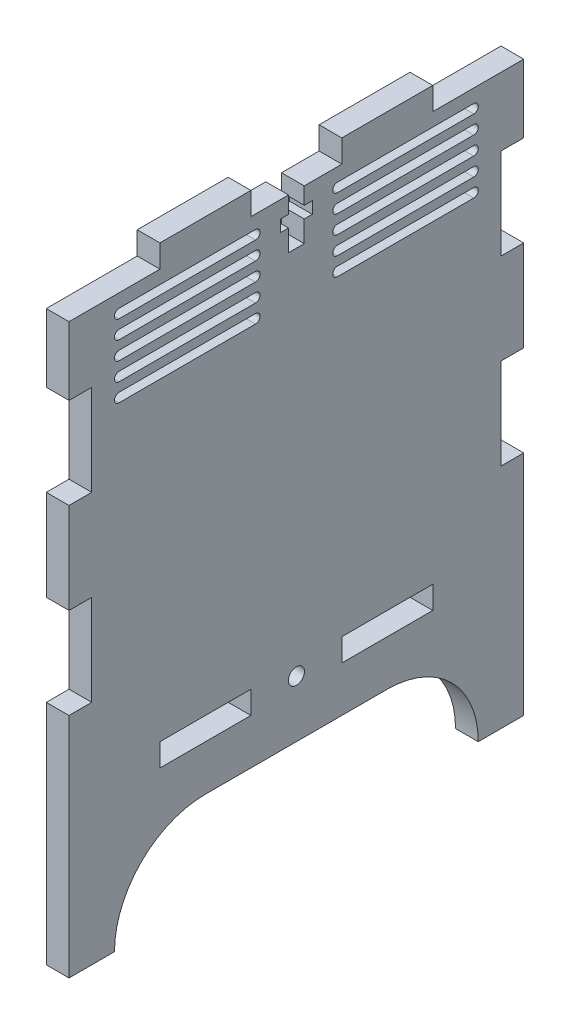
from build123d import *

# Parameters (mm, degrees)
SKETCH1_W                 = 127
SKETCH1_H                 = 165.1
BOSS_EXTRUDE1_DEPTH       = 6.35
SKETCH2_W                 = 25.4
SKETCH2_H                 = 6.35
CUT_EXTRUDE1_DEPTH        = 6.35
LPATTERN1_COUNT           = 3
LPATTERN1_PITCH           = 50.8
CUT_EXTRUDE4_DEPTH        = 6.35
SKETCH8_W                 = 6.35
SKETCH8_H                 = 25.4
CUT_EXTRUDE6_DEPTH        = 6.35
LPATTERN4_COUNT           = 2
LPATTERN4_PITCH           = 50.8
MIRROR1_COPY_1_SKETCH_W   = 6.35
MIRROR1_COPY_1_SKETCH_H   = 25.4
MIRROR1_COPY_1_DEPTH      = 6.35
MIRROR1_COPY_2_SKETCH_W   = 6.35
MIRROR1_COPY_2_SKETCH_H   = 25.4
MIRROR1_COPY_2_DEPTH      = 6.35
SKETCH9_W                 = 25.4
SKETCH9_H                 = 6.35
CUT_EXTRUDE7_DEPTH        = 6.35
LPATTERN6_COUNT           = 2
LPATTERN6_PITCH           = 50.8
SKETCH16_W                = 4.3942
SKETCH16_H                = 13.97
SKETCH16_W_2              = 8.89
SKETCH16_H_2              = 3.302
CUT_EXTRUDE14_DEPTH       = 6.35
F_8_CLEARANCE_HOLE1_D     = 4.4958
F_8_CLEARANCE_HOLE1_DEPTH = 10.16
F_8_CLEARANCE_HOLE1_TIP   = 1.350674586
CUT_EXTRUDE15_DEPTH       = 6.35
LPATTERN7_COPY_1_DEPTH    = 6.35
LPATTERN7_COPY_2_DEPTH    = 6.35
LPATTERN7_COPY_3_DEPTH    = 6.35
LPATTERN7_COPY_4_DEPTH    = 6.35
LPATTERN7_COPY_5_DEPTH    = 6.35
LPATTERN7_COPY_6_DEPTH    = 6.35
LPATTERN7_COPY_7_DEPTH    = 6.35
LPATTERN7_COPY_8_DEPTH    = 6.35


with BuildPart() as part:
    # Sketch1 → Boss-Extrude1 (new body)
    with BuildSketch(Plane(origin=(0, 0, 0), x_dir=(0, 0, -1), z_dir=(1, 0, 0))):
        Rectangle(SKETCH1_W, SKETCH1_H)
    extrude(amount=BOSS_EXTRUDE1_DEPTH)

    # Sketch2 → Cut-Extrude1 (cut)
    with BuildSketch(Plane(origin=(6.35, 0, 0), x_dir=(0, 0, -1), z_dir=(1, 0, 0))):
        with Locations((-50.8, 79.375)):
            Rectangle(SKETCH2_W, SKETCH2_H)
    cut_extrude1 = extrude(amount=-CUT_EXTRUDE1_DEPTH, mode=Mode.SUBTRACT)

    # LPattern1: Cut-Extrude1 ×3
    with Locations(*[(0, 0, -i * LPATTERN1_PITCH) for i in range(1, LPATTERN1_COUNT)]):
        add(cut_extrude1, mode=Mode.SUBTRACT)

    # Sketch5 → Cut-Extrude4 (cut)
    with BuildSketch(Plane(origin=(6.35, 0, 0), x_dir=(0, 0, -1), z_dir=(1, 0, 0))):
        with BuildLine():
            Line((-25.4, -57.15), (25.4, -57.15))
            ThreePointArc((25.4, -57.15), (50.8, -82.55), (25.4, -107.95))
            Line((25.4, -107.95), (-25.4, -107.95))
            ThreePointArc((-25.4, -107.95), (-50.8, -82.55), (-25.4, -57.15))
        make_face()
    extrude(amount=-CUT_EXTRUDE4_DEPTH, mode=Mode.SUBTRACT)

    # Sketch8 → Cut-Extrude6 (cut)
    with BuildSketch(Plane(origin=(6.35, 0, 0), x_dir=(0, 0, -1), z_dir=(1, 0, 0))):
        with Locations((60.325, 44.45)):
            Rectangle(SKETCH8_W, SKETCH8_H)
    cut_extrude6 = extrude(amount=-CUT_EXTRUDE6_DEPTH, mode=Mode.SUBTRACT)

    # LPattern4: Cut-Extrude6 ×2
    with Locations(*[(0, -i * LPATTERN4_PITCH, 0) for i in range(1, LPATTERN4_COUNT)]):
        add(cut_extrude6, mode=Mode.SUBTRACT)

    # Mirror1 copy 1 sketch → Mirror1 copy 1 (cut)
    with BuildSketch(Plane(origin=(6.35, -50.8, 0), x_dir=(0, 0, 1), z_dir=(1, 0, 0))):
        with Locations((60.325, -44.45)):
            Rectangle(MIRROR1_COPY_1_SKETCH_W, MIRROR1_COPY_1_SKETCH_H)
    extrude(amount=-MIRROR1_COPY_1_DEPTH, mode=Mode.SUBTRACT)

    # Mirror1 copy 2 sketch → Mirror1 copy 2 (cut)
    with BuildSketch(Plane(origin=(6.35, 0, 0), x_dir=(0, 0, 1), z_dir=(1, 0, 0))):
        with Locations((60.325, -44.45)):
            Rectangle(MIRROR1_COPY_2_SKETCH_W, MIRROR1_COPY_2_SKETCH_H)
    extrude(amount=-MIRROR1_COPY_2_DEPTH, mode=Mode.SUBTRACT)

    # Sketch9 → Cut-Extrude7 (cut)
    with BuildSketch(Plane.ZY):
        with Locations((-25.4, -41.275)):
            Rectangle(SKETCH9_W, SKETCH9_H)
    cut_extrude7 = extrude(amount=-CUT_EXTRUDE7_DEPTH, mode=Mode.SUBTRACT)

    # LPattern6: Cut-Extrude7 ×2
    with Locations(*[(0, 0, i * LPATTERN6_PITCH) for i in range(1, LPATTERN6_COUNT)]):
        add(cut_extrude7, mode=Mode.SUBTRACT)

    # Sketch16 → Cut-Extrude14 (cut)
    with BuildSketch(Plane.ZY):
        with Locations((0, 69.215)):
            Rectangle(SKETCH16_W, SKETCH16_H)
        with Locations((0, 69.85)):
            Rectangle(SKETCH16_W_2, SKETCH16_H_2)
    extrude(amount=-CUT_EXTRUDE14_DEPTH, mode=Mode.SUBTRACT)

    # #8 Clearance Hole1
    with Locations(Plane.ZY):
        with Locations((0, -41.275)):
            Hole(F_8_CLEARANCE_HOLE1_D / 2, depth=F_8_CLEARANCE_HOLE1_DEPTH)
            with Locations((0, 0, -(F_8_CLEARANCE_HOLE1_DEPTH + F_8_CLEARANCE_HOLE1_TIP / 2))):  # 118° drill point
                Cone(0, F_8_CLEARANCE_HOLE1_D / 2, F_8_CLEARANCE_HOLE1_TIP, mode=Mode.SUBTRACT)

    # Sketch19 → Cut-Extrude15 (cut)
    with BuildSketch(Plane.ZY):
        with BuildLine():
            Line((-49.53, 72.448860523), (-11.43, 72.448860523))
            ThreePointArc((-11.43, 72.448860523), (-10.16, 71.178860523), (-11.43, 69.908860523))
            Line((-11.43, 69.908860523), (-49.53, 69.908860523))
            ThreePointArc((-49.53, 69.908860523), (-50.8, 71.178860523), (-49.53, 72.448860523))
        make_face()
    cut_extrude15 = extrude(amount=-CUT_EXTRUDE15_DEPTH, mode=Mode.SUBTRACT)

    # Mirror2: Cut-Extrude15 across plane
    add(cut_extrude15.mirror(Plane.XY), mode=Mode.SUBTRACT)

    # LPattern7 copy 1 sketch → LPattern7 copy 1 (cut)
    with BuildSketch(Plane(origin=(0, -5.08, 0), x_dir=(0, 0, -1), z_dir=(-1, 0, 0))):
        with BuildLine():
            Line((-49.53, -72.448860523), (-11.43, -72.448860523))
            ThreePointArc((-11.43, -72.448860523), (-10.16, -71.178860523), (-11.43, -69.908860523))
            Line((-11.43, -69.908860523), (-49.53, -69.908860523))
            ThreePointArc((-49.53, -69.908860523), (-50.8, -71.178860523), (-49.53, -72.448860523))
        make_face()
    extrude(amount=-LPATTERN7_COPY_1_DEPTH, mode=Mode.SUBTRACT)

    # LPattern7 copy 2 sketch → LPattern7 copy 2 (cut)
    with BuildSketch(Plane(origin=(0, -10.16, 0), x_dir=(0, 0, -1), z_dir=(-1, 0, 0))):
        with BuildLine():
            Line((-49.53, -72.448860523), (-11.43, -72.448860523))
            ThreePointArc((-11.43, -72.448860523), (-10.16, -71.178860523), (-11.43, -69.908860523))
            Line((-11.43, -69.908860523), (-49.53, -69.908860523))
            ThreePointArc((-49.53, -69.908860523), (-50.8, -71.178860523), (-49.53, -72.448860523))
        make_face()
    extrude(amount=-LPATTERN7_COPY_2_DEPTH, mode=Mode.SUBTRACT)

    # LPattern7 copy 3 sketch → LPattern7 copy 3 (cut)
    with BuildSketch(Plane(origin=(0, -15.24, 0), x_dir=(0, 0, -1), z_dir=(-1, 0, 0))):
        with BuildLine():
            Line((-49.53, -72.448860523), (-11.43, -72.448860523))
            ThreePointArc((-11.43, -72.448860523), (-10.16, -71.178860523), (-11.43, -69.908860523))
            Line((-11.43, -69.908860523), (-49.53, -69.908860523))
            ThreePointArc((-49.53, -69.908860523), (-50.8, -71.178860523), (-49.53, -72.448860523))
        make_face()
    extrude(amount=-LPATTERN7_COPY_3_DEPTH, mode=Mode.SUBTRACT)

    # LPattern7 copy 4 sketch → LPattern7 copy 4 (cut)
    with BuildSketch(Plane(origin=(0, -20.32, 0), x_dir=(0, 0, -1), z_dir=(-1, 0, 0))):
        with BuildLine():
            Line((-49.53, -72.448860523), (-11.43, -72.448860523))
            ThreePointArc((-11.43, -72.448860523), (-10.16, -71.178860523), (-11.43, -69.908860523))
            Line((-11.43, -69.908860523), (-49.53, -69.908860523))
            ThreePointArc((-49.53, -69.908860523), (-50.8, -71.178860523), (-49.53, -72.448860523))
        make_face()
    extrude(amount=-LPATTERN7_COPY_4_DEPTH, mode=Mode.SUBTRACT)

    # LPattern7 copy 5 sketch → LPattern7 copy 5 (cut)
    with BuildSketch(Plane(origin=(0, -5.08, 0), x_dir=(0, 0, 1), z_dir=(-1, 0, 0))):
        with BuildLine():
            Line((-49.53, 72.448860523), (-11.43, 72.448860523))
            ThreePointArc((-11.43, 72.448860523), (-10.16, 71.178860523), (-11.43, 69.908860523))
            Line((-11.43, 69.908860523), (-49.53, 69.908860523))
            ThreePointArc((-49.53, 69.908860523), (-50.8, 71.178860523), (-49.53, 72.448860523))
        make_face()
    extrude(amount=-LPATTERN7_COPY_5_DEPTH, mode=Mode.SUBTRACT)

    # LPattern7 copy 6 sketch → LPattern7 copy 6 (cut)
    with BuildSketch(Plane(origin=(0, -10.16, 0), x_dir=(0, 0, 1), z_dir=(-1, 0, 0))):
        with BuildLine():
            Line((-49.53, 72.448860523), (-11.43, 72.448860523))
            ThreePointArc((-11.43, 72.448860523), (-10.16, 71.178860523), (-11.43, 69.908860523))
            Line((-11.43, 69.908860523), (-49.53, 69.908860523))
            ThreePointArc((-49.53, 69.908860523), (-50.8, 71.178860523), (-49.53, 72.448860523))
        make_face()
    extrude(amount=-LPATTERN7_COPY_6_DEPTH, mode=Mode.SUBTRACT)

    # LPattern7 copy 7 sketch → LPattern7 copy 7 (cut)
    with BuildSketch(Plane(origin=(0, -15.24, 0), x_dir=(0, 0, 1), z_dir=(-1, 0, 0))):
        with BuildLine():
            Line((-49.53, 72.448860523), (-11.43, 72.448860523))
            ThreePointArc((-11.43, 72.448860523), (-10.16, 71.178860523), (-11.43, 69.908860523))
            Line((-11.43, 69.908860523), (-49.53, 69.908860523))
            ThreePointArc((-49.53, 69.908860523), (-50.8, 71.178860523), (-49.53, 72.448860523))
        make_face()
    extrude(amount=-LPATTERN7_COPY_7_DEPTH, mode=Mode.SUBTRACT)

    # LPattern7 copy 8 sketch → LPattern7 copy 8 (cut)
    with BuildSketch(Plane(origin=(0, -20.32, 0), x_dir=(0, 0, 1), z_dir=(-1, 0, 0))):
        with BuildLine():
            Line((-49.53, 72.448860523), (-11.43, 72.448860523))
            ThreePointArc((-11.43, 72.448860523), (-10.16, 71.178860523), (-11.43, 69.908860523))
            Line((-11.43, 69.908860523), (-49.53, 69.908860523))
            ThreePointArc((-49.53, 69.908860523), (-50.8, 71.178860523), (-49.53, 72.448860523))
        make_face()
    extrude(amount=-LPATTERN7_COPY_8_DEPTH, mode=Mode.SUBTRACT)


solid = part.part
